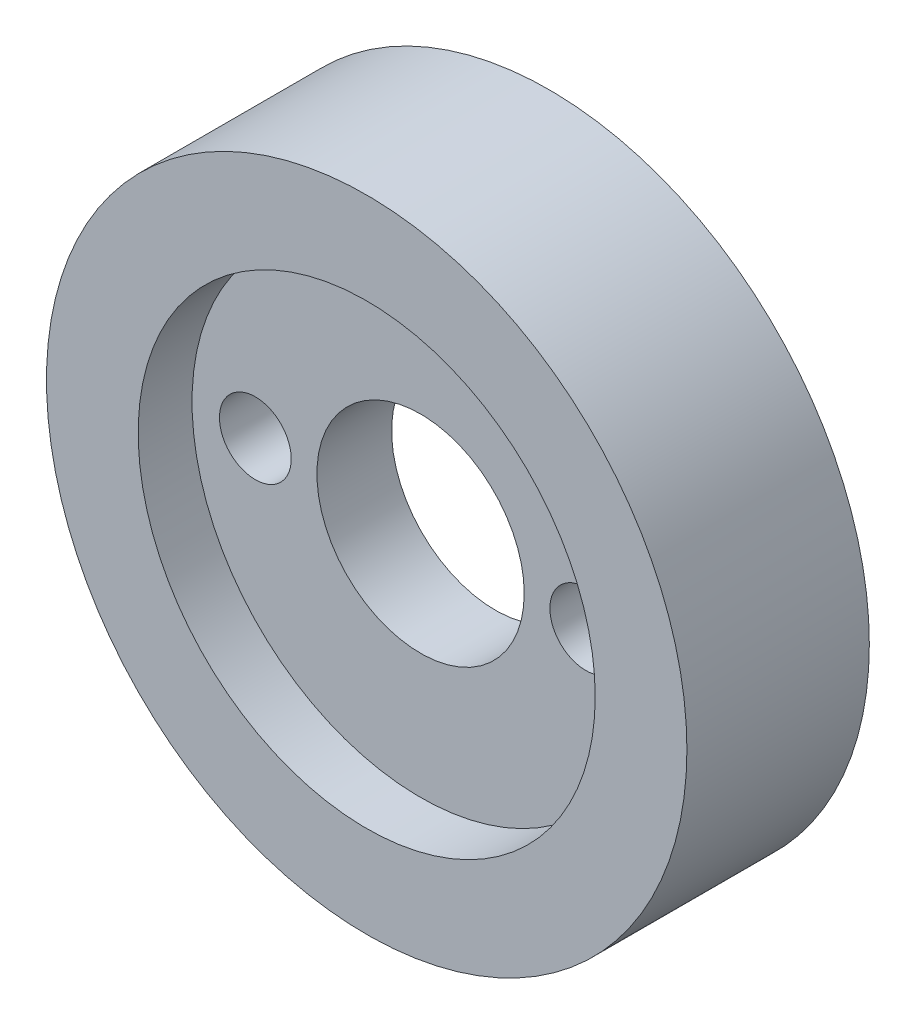
from build123d import *

# Parameters (mm, degrees)
SKETCH1_R           = 9.80909091
SKETCH1_R_2         = 3.175
BOSS_EXTRUDE1_DEPTH = 2.794
CUT_EXTRUDE1_START  = -1.65
SKETCH2_R           = 1.1
CUT_EXTRUDE1_DEPTH  = 1.65
SKETCH2_3_R         = 1.1
CUT_EXTRUDE2_DEPTH  = 15.955342623


with BuildPart() as part:
    # Sketch1 → Boss-Extrude1 (new, symmetric)
    with BuildSketch(Plane.XY):
        Circle(SKETCH1_R)
        Circle(SKETCH1_R_2, mode=Mode.SUBTRACT)
    extrude(amount=BOSS_EXTRUDE1_DEPTH, both=True)

    # Sketch2 → Cut-Extrude1 (cut)
    with BuildSketch(Plane.XY.offset(2.794).offset(CUT_EXTRUDE1_START)):
        with BuildLine():
            ThreePointArc((7, 0), (0, 7), (-7, 0))
            ThreePointArc((-7, 0), (0, -7), (7, 0))
        make_face()
        with BuildLine():
            ThreePointArc((-3.96095, 0), (-5.06095, -1.1), (-6.16095, 0))
            ThreePointArc((-6.16095, 0), (-5.06095, 1.1), (-3.96095, 0))
        make_face(mode=Mode.SUBTRACT)
        with BuildLine():
            ThreePointArc((3.175, 0), (0, -3.175), (-3.175, 0))
            ThreePointArc((-3.175, 0), (0, 3.175), (3.175, 0))
        make_face(mode=Mode.SUBTRACT)
        with Locations((5.06095, 0)):
            Circle(SKETCH2_R, mode=Mode.SUBTRACT)
    cut_extrude1 = extrude(amount=CUT_EXTRUDE1_DEPTH, mode=Mode.SUBTRACT)

    # Mirror1: Cut-Extrude1 across plane
    add(cut_extrude1.mirror(Plane.XY), mode=Mode.SUBTRACT)

    # Sketch2<3> → Cut-Extrude2 (cut, through all)
    with BuildSketch(Plane.XY.offset(2.794)):
        with Locations((-5.06095, 0)):
            Circle(SKETCH2_3_R)
        with Locations((5.06095, 0)):
            Circle(SKETCH2_3_R)
    extrude(amount=-CUT_EXTRUDE2_DEPTH, mode=Mode.SUBTRACT)


solid = part.part
